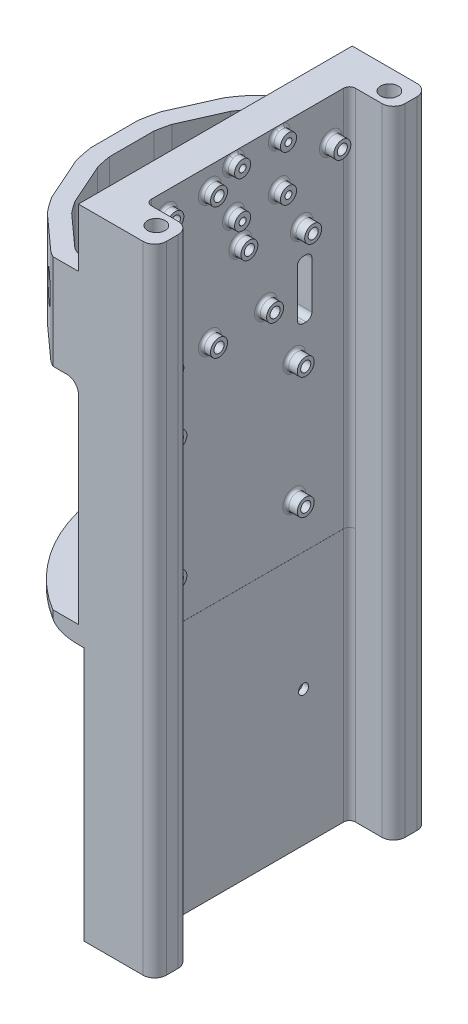
from build123d import *

# Parameters (mm, degrees)
SKETCH1_R                       = 69.85
BOSS_EXTRUDE1_DEPTH             = 12.7
BOSS_EXTRUDE2_START             = 254
BOSS_EXTRUDE2_DEPTH             = 254
SKETCH3_W                       = 6.35
SKETCH3_H                       = 80.01
SKETCH8_W                       = 51.494926749
SKETCH8_H                       = 127.916180553
CUT_EXTRUDE2_DEPTH              = 99.568
CUT_EXTRUDE3_DEPTH              = 7.62
CUT_EXTRUDE3_DEPTH_BACK         = 80.01
CUT_EXTRUDE3_START              = -173.99
SKETCH8_2_W                     = 51.494926749
SKETCH8_2_H                     = 127.916180553
CUT_EXTRUDE4_DEPTH              = 66.802
FILLET13_R                      = 5.08
FILLET3_R                       = 17.78
SKETCH11_R                      = 6.35
CUT_EXTRUDE6_DEPTH              = 14.986
CIRPATTERN1_COUNT               = 3
CIRPATTERN1_ANGLE               = 48
CIRPATTERN1_THE_OTHER_WAY_COUNT = 3
CIRPATTERN1_THE_OTHER_WAY_ANGLE = 48
BOSS_EXTRUDE3_DEPTH             = 7.62
SKETCH6_R                       = 3.81
CUT_EXTRUDE1_DEPTH              = 448.31
FILLET6_R                       = 5.08
SKETCH18_R                      = 2.2
FEATHERWEIGHT_GPS_DEPTH         = 5
SKETCH19_R                      = 2.2
BATTERY_MOUNTS_DEPTH            = 5
SKETCH21_R                      = 2.2
TELEMETRUM_HOLES_DEPTH          = 5
SKETCH22_R                      = 2.2
BLUE_RAVEN_HOLES_DEPTH          = 5
BOSS_EXTRUDE4_START             = 4
SKETCH22_5_R                    = 3.7
SKETCH22_5_R_2                  = 2.2
BOSS_EXTRUDE4_DEPTH             = 4
BOSS_EXTRUDE5_START             = 4
SKETCH21_4_R                    = 3.7
SKETCH21_4_R_2                  = 2.2
BOSS_EXTRUDE5_DEPTH             = 4
BOSS_EXTRUDE6_START             = 5
SKETCH18_3_R                    = 3.7
SKETCH18_3_R_2                  = 2.2
BOSS_EXTRUDE6_DEPTH             = 5
SKETCH23_R                      = 2.2
SRAD_HOLES_DEPTH                = 4
CUT_EXTRUDE11_START             = -12.7
SKETCH25_R                      = 73.406
CUT_EXTRUDE11_DEPTH             = 87.63
SKETCH27_R                      = 105.86041663
CUT_EXTRUDE12_DEPTH             = 22.606
CUT_EXTRUDE13_DEPTH             = 25.4
SKETCH31_R                      = 1.5
DVR_HOLES_DEPTH                 = 4
SKETCH31_3_R                    = 3.5
SKETCH31_3_R_2                  = 1.5
BOSS_EXTRUDE9_DEPTH             = 4
SKETCH32_R                      = 2.2
CUT_EXTRUDE17_DEPTH             = 5
FILLET9_R                       = 1.27
FILLET10_R                      = 1.27
FILLET11_R                      = 1.27
SKETCH23_6_R                    = 3.683
SKETCH23_6_R_2                  = 2.2
BOSS_EXTRUDE10_DEPTH            = 5
FILLET12_R                      = 1.27
SKETCH33_W                      = 25.134973306
SKETCH33_H                      = 41.402
CUT_EXTRUDE18_DEPTH             = 0.762
CIRPATTERN2_COUNT               = 3
CIRPATTERN2_ANGLE               = 48
CIRPATTERN2_THE_OTHER_WAY_COUNT = 3
CIRPATTERN2_THE_OTHER_WAY_ANGLE = 48
BOSS_EXTRUDE11_START            = -0.254
SKETCH35_W                      = 21.082
SKETCH35_H                      = 41.402
SKETCH35_R                      = 6.35
BOSS_EXTRUDE11_DEPTH            = 1.016
CIRPATTERN3_COUNT               = 3
CIRPATTERN3_ANGLE               = 48
CIRPATTERN3_THE_OTHER_WAY_COUNT = 3
CIRPATTERN3_THE_OTHER_WAY_ANGLE = 48
CUT_EXTRUDE21_DEPTH             = 265.731316086
SKETCH41_R                      = 3.81
BOSS_EXTRUDE12_DEPTH            = 110.744
CUT_EXTRUDE20_DEPTH             = 110.744
CUT_EXTRUDE20_DEPTH_BACK        = 2.54
SKETCH39_R                      = 2.2


with BuildPart() as part:
    # Sketch1 → Boss-Extrude1 (new body)
    with BuildSketch(Plane(origin=(0, 0, 0), x_dir=(1, 0, 0), z_dir=(0, 1, 0))):
        with Locations(Location((0, 0, 0), (0, 0, 270))):
            Circle(SKETCH1_R)
    extrude(amount=BOSS_EXTRUDE1_DEPTH)

    # Sketch2 → Boss-Extrude2 (add)
    with BuildSketch(Plane.XZ.offset(BOSS_EXTRUDE2_START)):
        with BuildLine():
            Line((-36.278456417, 59.69), (-7.068456417, 59.69))
            Line((-7.068456417, 59.69), (3.091543583, 59.69))
            ThreePointArc((3.091543583, 59.69), (6.683646031, 58.202102448), (8.171543583, 54.61))
            Line((8.171543583, 54.61), (8.171543583, 49.53))
            ThreePointArc((8.171543583, 49.53), (6.683646031, 45.937897552), (3.091543583, 44.45))
            Line((3.091543583, 44.45), (-8.510396002, 44.45))
            ThreePointArc((-8.510396002, 44.45), (-10.306447226, 43.706051224), (-11.050396002, 41.91))
            Line((-11.050396002, 41.91), (-11.050396002, -41.91))
            ThreePointArc((-11.050396002, -41.91), (-10.306447226, -43.706051224), (-8.510396002, -44.45))
            Line((-8.510396002, -44.45), (3.091543583, -44.45))
            ThreePointArc((3.091543583, -44.45), (6.683646031, -45.937897552), (8.171543583, -49.53))
            Line((8.171543583, -49.53), (8.171543583, -54.61))
            ThreePointArc((8.171543583, -54.61), (6.683646031, -58.202102448), (3.091543583, -59.69))
            Line((3.091543583, -59.69), (-7.068456417, -59.69))
            Line((-7.068456417, -59.69), (-36.278456417, -59.69))
            ThreePointArc((-36.278456417, -59.69), (-69.85, 0), (-36.278456417, 59.69))
        make_face()
    extrude(amount=-BOSS_EXTRUDE2_DEPTH)

    # Sketch3 → Cut-Revolve1 (revolve, cut)
    with BuildSketch(Plane.XY):
        with Locations((-66.675, -40.005)):
            Rectangle(SKETCH3_W, SKETCH3_H)
    revolve(axis=Axis((0, 0, 0), (0, 1, 0)), mode=Mode.SUBTRACT)

    # Sketch8 → Cut-Extrude2 (cut)
    with BuildSketch(Plane.XZ.offset(254)):
        with Locations((-50.833934193, -0.517879274)):
            Rectangle(SKETCH8_W, SKETCH8_H)
    extrude(amount=-CUT_EXTRUDE2_DEPTH, mode=Mode.SUBTRACT)

    # Sketch8<2> → Cut-Extrude3 (cut, two sides: drawn at the far end of the back side and taken through both)
    with BuildSketch(Plane.XZ.offset(254).offset(CUT_EXTRUDE3_START - CUT_EXTRUDE3_DEPTH_BACK)):
        with Locations((-50.833934193, -0.517879274)):
            Rectangle(SKETCH8_2_W, SKETCH8_2_H)
    extrude(amount=CUT_EXTRUDE3_DEPTH + CUT_EXTRUDE3_DEPTH_BACK, mode=Mode.SUBTRACT)

    # Sketch9 → Cut-Extrude4 (cut)
    with BuildSketch(Plane.XZ.offset(154.432)):
        with BuildLine():
            Line((-25.086470819, 53.552354019), (-31.964771747, 53.552354019))
            ThreePointArc((-31.964771747, 53.552354019), (-62.366667811, 0), (-31.964771747, -53.552354019))
            Line((-31.964771747, -53.552354019), (-25.086470819, -53.552354019))
            Line((-25.086470819, -53.552354019), (-25.086470819, 53.552354019))
        make_face()
    extrude(amount=-CUT_EXTRUDE4_DEPTH, mode=Mode.SUBTRACT)

    # Fillet13
    fillet13_edges = [part.edges().sort_by_distance(p)[0] for p in [
        (-25.086470819, -87.63, -56.62117701),
        (-25.086470819, -154.432, 56.62117701),
        (-25.086470819, -121.031, -53.552354019),
        (-25.086470819, -121.031, 53.552354019),
        (-25.086470819, -154.432, -56.62117701),
        (-25.086470819, -87.63, 56.62117701),
    ]]
    fillet(fillet13_edges, radius=FILLET13_R)

    # Fillet3
    # the kernel refuses this fillet: 17.78 mm, written as the material it adds along each edge
    with BuildSketch(Plane(origin=(-31.964771747, -154.432, -53.552354019), x_dir=(1, 0, 0), z_dir=(0, 1, 0))) as fillet3_piece_1:
        with BuildLine():
            CenterArc((6.062885135, -17.260988429), FILLET3_R, 103.877857389, 21.638365739)
            Line((-4.266111549, -2.788938557), (-4.472691483, -2.499497559))
            ThreePointArc((-4.472691483, -2.499497559), (-2.356138329, -1.053230113), (-0.182255574, 0.305342866))
            Line((-0.182255574, 0.305342866), (0, 0.3556))
            ThreePointArc((0, 0.3556), (0.899150464, 0.3556), (1.713009244, 0.345219769))
            Line((1.713009244, 0.345219769), (1.798300928, 0))
        make_face()
    extrude(amount=66.802)
    with BuildSketch(Plane(origin=(-31.964771747, -154.432, 53.552354019), x_dir=(1, 0, 0), z_dir=(0, 1, 0))) as fillet3_piece_2:
        with BuildLine():
            CenterArc((6.062885135, 17.260988429), FILLET3_R, 234.483776873, 21.638365739)
            Line((-4.266111549, 2.788938557), (-4.472691483, 2.499497559))
            ThreePointArc((-4.472691483, 2.499497559), (-2.356138329, 1.053230113), (-0.182255574, -0.305342866))
            Line((-0.182255574, -0.305342866), (0, -0.3556))
            ThreePointArc((0, -0.3556), (0.899150464, -0.3556), (1.713009244, -0.345219769))
            Line((1.713009244, -0.345219769), (1.798300928, 0))
        make_face()
    extrude(amount=66.802)

    # Sketch11 → Cut-Extrude6 (cut)
    with BuildSketch(Plane(origin=(-69.85, -87.63, 0), x_dir=(0, 0, 1), z_dir=(-1, 0, 0))):
        with Locations((0, -45.72)):
            Circle(SKETCH11_R)
    cut_extrude6 = extrude(amount=-CUT_EXTRUDE6_DEPTH, mode=Mode.SUBTRACT)

    # CirPattern1: Cut-Extrude6 ×3 about axis
    cirpattern1_axis = Axis((0, 0, 0), (0, 1, 0))
    for i in range(1, CIRPATTERN1_COUNT):
        add(cut_extrude6.rotate(cirpattern1_axis, i * CIRPATTERN1_ANGLE / (CIRPATTERN1_COUNT - 1)), mode=Mode.SUBTRACT)

    # CirPattern1 the other way: Cut-Extrude6 ×3 about axis
    cirpattern1_the_other_way_axis = Axis((0, 0, 0), (0, -1, 0))
    for i in range(1, CIRPATTERN1_THE_OTHER_WAY_COUNT):
        add(cut_extrude6.rotate(cirpattern1_the_other_way_axis, i * CIRPATTERN1_THE_OTHER_WAY_ANGLE / (CIRPATTERN1_THE_OTHER_WAY_COUNT - 1)), mode=Mode.SUBTRACT)

    # Sketch13 → Boss-Extrude3 (add)
    with BuildSketch(Plane.XZ.offset(254)):
        with BuildLine():
            Line((-36.278456417, 59.69), (-18.57051046, 59.69))
            ThreePointArc((-18.57051046, 59.69), (-14.978408012, 58.202102448), (-13.49051046, 54.61))
            Line((-13.49051046, 54.61), (-13.49051046, -54.61))
            ThreePointArc((-13.49051046, -54.61), (-14.978408012, -58.202102448), (-18.57051046, -59.69))
            Line((-18.57051046, -59.69), (-36.278456417, -59.69))
            ThreePointArc((-36.278456417, -59.69), (-69.85, 0), (-36.278456417, 59.69))
        make_face()
    extrude(amount=-BOSS_EXTRUDE3_DEPTH)

    # Sketch6 → Cut-Extrude1 (cut)
    with BuildSketch(Plane(origin=(0, 12.7, 0), x_dir=(1, 0, 0), z_dir=(0, 1, 0))):
        with Locations(Location((0, 50.8, 0), (0, 0, 270))):
            Circle(SKETCH6_R)
        with Locations(Location((0, -50.8, 0), (0, 0, 270))):
            Circle(SKETCH6_R)
    extrude(amount=-CUT_EXTRUDE1_DEPTH, mode=Mode.SUBTRACT)

    # Fillet6
    fillet6_edges = [part.edges().sort_by_distance(p)[0] for p in [
        (-69.85, -254, 0),
    ]]
    fillet(fillet6_edges, radius=FILLET6_R)

    # Sketch18 → Featherweight GPS (cut)
    with BuildSketch(Plane(origin=(-11.050396002, 0, 0), x_dir=(0, 0, -1), z_dir=(1, 0, 0))):
        with Locations((23.630408371, -130.916639993)):
            Circle(SKETCH18_R)
        with Locations((36.330408371, -105.516639993)):
            Circle(SKETCH18_R)
    extrude(amount=-FEATHERWEIGHT_GPS_DEPTH, mode=Mode.SUBTRACT)

    # Sketch19 → Battery Mounts (cut)
    with BuildSketch(Plane.ZY.offset(25.086470819)):
        with Locations((-42, -204.891080852)):
            Circle(SKETCH19_R)
        with Locations((-21, -204.891080852)):
            Circle(SKETCH19_R)
        with Locations((0, -204.891080852)):
            Circle(SKETCH19_R)
        with Locations((21, -204.891080852)):
            Circle(SKETCH19_R)
        with Locations((42, -204.891080852)):
            Circle(SKETCH19_R)
    extrude(amount=-BATTERY_MOUNTS_DEPTH, mode=Mode.SUBTRACT)

    # Sketch21 → Telemetrum Holes (cut)
    with BuildSketch(Plane(origin=(-11.050396002, 0, 0), x_dir=(0, 0, -1), z_dir=(1, 0, 0))):
        with Locations((-35.475786378, -97.243458943)):
            Circle(SKETCH21_R)
        with Locations((-16.425786378, -97.243458943)):
            Circle(SKETCH21_R)
        with Locations((-35.475786378, -154.393458943)):
            Circle(SKETCH21_R)
        with Locations((-16.425786378, -154.393458943)):
            Circle(SKETCH21_R)
    extrude(amount=-TELEMETRUM_HOLES_DEPTH, mode=Mode.SUBTRACT)

    # Sketch22 → Blue Raven Holes (cut)
    with BuildSketch(Plane(origin=(-11.050396002, 0, 0), x_dir=(0, 0, -1), z_dir=(1, 0, 0))):
        with Locations((-3.202157139, -124.186848052)):
            Circle(SKETCH22_R)
        with Locations((8.028979611, -153.396848052)):
            Circle(SKETCH22_R)
    extrude(amount=-BLUE_RAVEN_HOLES_DEPTH, mode=Mode.SUBTRACT)

    # Sketch22<5> → Boss-Extrude4 (add)
    # profile 1 of 2: a face of its own
    with BuildSketch(Plane(origin=(-11.050396002, 0, 0), x_dir=(0, 0, -1), z_dir=(1, 0, 0)).offset(BOSS_EXTRUDE4_START)):
        with Locations(Location((-3.202157139, -124.186848052, 0), (0, 0, 180))):
            Circle(SKETCH22_5_R)
        with Locations((-3.202157139, -124.186848052)):
            Circle(SKETCH22_5_R_2, mode=Mode.SUBTRACT)
    # profile 2 of 2: a face of its own
    with BuildSketch(Plane(origin=(-11.050396002, 0, 0), x_dir=(0, 0, -1), z_dir=(1, 0, 0)).offset(BOSS_EXTRUDE4_START)):
        with Locations(Location((8.028979611, -153.396848052, 0), (0, 0, 180))):
            Circle(SKETCH22_5_R)
        with Locations((8.028979611, -153.396848052)):
            Circle(SKETCH22_5_R_2, mode=Mode.SUBTRACT)
    extrude(amount=-BOSS_EXTRUDE4_DEPTH)

    # Sketch21<4> → Boss-Extrude5 (add)
    # profile 1 of 4: a face of its own
    with BuildSketch(Plane(origin=(-11.050396002, 0, 0), x_dir=(0, 0, -1), z_dir=(1, 0, 0)).offset(BOSS_EXTRUDE5_START)):
        with Locations(Location((-35.475786378, -97.243458943, 0), (0, 0, 180))):
            Circle(SKETCH21_4_R)
        with Locations((-35.475786378, -97.243458943)):
            Circle(SKETCH21_4_R_2, mode=Mode.SUBTRACT)
    # profile 2 of 4: a face of its own
    with BuildSketch(Plane(origin=(-11.050396002, 0, 0), x_dir=(0, 0, -1), z_dir=(1, 0, 0)).offset(BOSS_EXTRUDE5_START)):
        with Locations(Location((-16.425786378, -97.243458943, 0), (0, 0, 180))):
            Circle(SKETCH21_4_R)
        with Locations((-16.425786378, -97.243458943)):
            Circle(SKETCH21_4_R_2, mode=Mode.SUBTRACT)
    # profile 3 of 4: a face of its own
    with BuildSketch(Plane(origin=(-11.050396002, 0, 0), x_dir=(0, 0, -1), z_dir=(1, 0, 0)).offset(BOSS_EXTRUDE5_START)):
        with Locations(Location((-35.475786378, -154.393458943, 0), (0, 0, 180))):
            Circle(SKETCH21_4_R)
        with Locations((-35.475786378, -154.393458943)):
            Circle(SKETCH21_4_R_2, mode=Mode.SUBTRACT)
    # profile 4 of 4: a face of its own
    with BuildSketch(Plane(origin=(-11.050396002, 0, 0), x_dir=(0, 0, -1), z_dir=(1, 0, 0)).offset(BOSS_EXTRUDE5_START)):
        with Locations(Location((-16.425786378, -154.393458943, 0), (0, 0, 180))):
            Circle(SKETCH21_4_R)
        with Locations((-16.425786378, -154.393458943)):
            Circle(SKETCH21_4_R_2, mode=Mode.SUBTRACT)
    extrude(amount=-BOSS_EXTRUDE5_DEPTH)

    # Sketch18<3> → Boss-Extrude6 (add)
    # profile 1 of 2: a face of its own
    with BuildSketch(Plane(origin=(-11.050396002, 0, 0), x_dir=(0, 0, -1), z_dir=(1, 0, 0)).offset(BOSS_EXTRUDE6_START)):
        with Locations(Location((23.630408371, -130.916639993, 0), (0, 0, 180))):
            Circle(SKETCH18_3_R)
        with Locations((23.630408371, -130.916639993)):
            Circle(SKETCH18_3_R_2, mode=Mode.SUBTRACT)
    # profile 2 of 2: a face of its own
    with BuildSketch(Plane(origin=(-11.050396002, 0, 0), x_dir=(0, 0, -1), z_dir=(1, 0, 0)).offset(BOSS_EXTRUDE6_START)):
        with Locations(Location((36.330408371, -105.516639993, 0), (0, 0, 180))):
            Circle(SKETCH18_3_R)
        with Locations((36.330408371, -105.516639993)):
            Circle(SKETCH18_3_R_2, mode=Mode.SUBTRACT)
    extrude(amount=-BOSS_EXTRUDE6_DEPTH)

    # Sketch23 → SRAD Holes (cut)
    with BuildSketch(Plane(origin=(-11.050396002, 0, 0), x_dir=(0, 0, -1), z_dir=(1, 0, 0))):
        with Locations((-35.121812791, -179.485326742)):
            Circle(SKETCH23_R)
        with Locations((20.378187209, -179.485326742)):
            Circle(SKETCH23_R)
        with Locations((-35.121812791, -232.485326742)):
            Circle(SKETCH23_R)
        with Locations((20.378187209, -232.485326742)):
            Circle(SKETCH23_R)
    extrude(amount=-SRAD_HOLES_DEPTH, mode=Mode.SUBTRACT)

    # Sketch25 → Cut-Extrude11 (cut)
    with BuildSketch(Plane(origin=(0, 12.7, 0), x_dir=(1, 0, 0), z_dir=(0, 1, 0)).offset(CUT_EXTRUDE11_START)):
        Circle(SKETCH25_R)
    extrude(amount=-CUT_EXTRUDE11_DEPTH, mode=Mode.SUBTRACT)


with BuildPart() as cut_extrude11_piece_1:
    # of the separate pieces the step leaves, piece 1, a body of its own (cut_extrude11_pieces)
    add(part.part.solids().sort_by_distance((-25.144717139, -254, 59.69))[0])

    # Sketch28 → Cut-Extrude13 (cut)
    with BuildSketch(Plane(origin=(0, -87.63, 0), x_dir=(1, 0, 0), z_dir=(0, 1, 0))):
        with BuildLine():
            Line((-25.086470819, -65.189657783), (-25.086470819, 65.189657783))
            ThreePointArc((-25.086470819, 65.189657783), (-69.85, 0), (-25.086470819, -65.189657783))
        make_face()
    extrude(amount=-CUT_EXTRUDE13_DEPTH, mode=Mode.SUBTRACT)

    # Sketch31 → DVR Holes (cut)
    with BuildSketch(Plane(origin=(-11.050396002, 0, 0), x_dir=(0, 0, -1), z_dir=(1, 0, 0))):
        with Locations((-6.137953822, -91.979966401)):
            Circle(SKETCH31_R)
        with Locations((13.862046178, -91.979966401)):
            Circle(SKETCH31_R)
        with Locations((-6.137953822, -111.979966401)):
            Circle(SKETCH31_R)
        with Locations((13.862046178, -111.979966401)):
            Circle(SKETCH31_R)
    extrude(amount=-DVR_HOLES_DEPTH, mode=Mode.SUBTRACT)

    # Sketch31<3> → Boss-Extrude9 (add)
    # profile 1 of 4: a face of its own
    with BuildSketch(Plane(origin=(-11.050396002, 0, 0), x_dir=(0, 0, -1), z_dir=(1, 0, 0))):
        with Locations(Location((-6.137953822, -91.979966401, 0), (0, 0, 180))):
            Circle(SKETCH31_3_R)
        with Locations((-6.137953822, -91.979966401)):
            Circle(SKETCH31_3_R_2, mode=Mode.SUBTRACT)
    # profile 2 of 4: a face of its own
    with BuildSketch(Plane(origin=(-11.050396002, 0, 0), x_dir=(0, 0, -1), z_dir=(1, 0, 0))):
        with Locations(Location((13.862046178, -91.979966401, 0), (0, 0, 180))):
            Circle(SKETCH31_3_R)
        with Locations((13.862046178, -91.979966401)):
            Circle(SKETCH31_3_R_2, mode=Mode.SUBTRACT)
    # profile 3 of 4: a face of its own
    with BuildSketch(Plane(origin=(-11.050396002, 0, 0), x_dir=(0, 0, -1), z_dir=(1, 0, 0))):
        with Locations(Location((13.862046178, -111.979966401, 0), (0, 0, 180))):
            Circle(SKETCH31_3_R)
        with Locations((13.862046178, -111.979966401)):
            Circle(SKETCH31_3_R_2, mode=Mode.SUBTRACT)
    # profile 4 of 4: a face of its own
    with BuildSketch(Plane(origin=(-11.050396002, 0, 0), x_dir=(0, 0, -1), z_dir=(1, 0, 0))):
        with Locations(Location((-6.137953822, -111.979966401, 0), (0, 0, 180))):
            Circle(SKETCH31_3_R)
        with Locations((-6.137953822, -111.979966401)):
            Circle(SKETCH31_3_R_2, mode=Mode.SUBTRACT)
    extrude(amount=BOSS_EXTRUDE9_DEPTH)

    # Sketch32 → Cut-Extrude17 (cut)
    with BuildSketch(Plane.ZY.offset(25.086470819)):
        with Locations((0, -99.040462544)):
            Circle(SKETCH32_R)
    extrude(amount=-CUT_EXTRUDE17_DEPTH, mode=Mode.SUBTRACT)

    # Fillet9
    fillet9_edges = [cut_extrude11_piece_1.edges().sort_by_distance(p)[0] for p in [
        (-11.050396002, -130.916639993, -27.330408371),
        (-11.050396002, -105.516639993, -40.030408371),
    ]]
    fillet(fillet9_edges, radius=FILLET9_R)

    # Fillet10
    fillet10_edges = [cut_extrude11_piece_1.edges().sort_by_distance(p)[0] for p in [
        (-11.050396002, -153.396848052, -11.728979611),
        (-11.050396002, -154.393458943, 31.775786378),
        (-11.050396002, -154.393458943, 12.725786378),
        (-11.050396002, -97.243458943, 12.725786378),
        (-11.050396002, -97.243458943, 31.775786378),
        (-11.050396002, -124.186848052, -0.497842861),
    ]]
    fillet(fillet10_edges, radius=FILLET10_R)

    # Fillet11
    fillet11_edges = [cut_extrude11_piece_1.edges().sort_by_distance(p)[0] for p in [
        (-11.050396002, -91.979966401, -17.362046178),
        (-11.050396002, -111.979966401, 2.637953822),
        (-11.050396002, -91.979966401, 2.637953822),
        (-11.050396002, -111.979966401, -17.362046178),
    ]]
    fillet(fillet11_edges, radius=FILLET11_R)

    # Sketch23<6> → Boss-Extrude10 (add)
    # profile 1 of 4: a face of its own
    with BuildSketch(Plane(origin=(-11.050396002, 0, 0), x_dir=(0, 0, -1), z_dir=(1, 0, 0))):
        with Locations(Location((-35.121812791, -179.485326742, 0), (0, 0, 180))):
            Circle(SKETCH23_6_R)
        with Locations((-35.121812791, -179.485326742)):
            Circle(SKETCH23_6_R_2, mode=Mode.SUBTRACT)
    # profile 2 of 4: a face of its own
    with BuildSketch(Plane(origin=(-11.050396002, 0, 0), x_dir=(0, 0, -1), z_dir=(1, 0, 0))):
        with Locations(Location((20.378187209, -179.485326742, 0), (0, 0, 180))):
            Circle(SKETCH23_6_R)
        with Locations((20.378187209, -179.485326742)):
            Circle(SKETCH23_6_R_2, mode=Mode.SUBTRACT)
    # profile 3 of 4: a face of its own
    with BuildSketch(Plane(origin=(-11.050396002, 0, 0), x_dir=(0, 0, -1), z_dir=(1, 0, 0))):
        with Locations(Location((-35.121812791, -232.485326742, 0), (0, 0, 180))):
            Circle(SKETCH23_6_R)
        with Locations((-35.121812791, -232.485326742)):
            Circle(SKETCH23_6_R_2, mode=Mode.SUBTRACT)
    # profile 4 of 4: a face of its own
    with BuildSketch(Plane(origin=(-11.050396002, 0, 0), x_dir=(0, 0, -1), z_dir=(1, 0, 0))):
        with Locations(Location((20.378187209, -232.485326742, 0), (0, 0, 180))):
            Circle(SKETCH23_6_R)
        with Locations((20.378187209, -232.485326742)):
            Circle(SKETCH23_6_R_2, mode=Mode.SUBTRACT)
    extrude(amount=BOSS_EXTRUDE10_DEPTH)

    # Fillet12
    fillet12_edges = [cut_extrude11_piece_1.edges().sort_by_distance(p)[0] for p in [
        (-11.050396002, -179.485326742, 31.438812791),
        (-11.050396002, -232.485326742, -24.061187209),
        (-11.050396002, -232.485326742, 31.438812791),
        (-11.050396002, -179.485326742, -24.061187209),
    ]]
    fillet(fillet12_edges, radius=FILLET12_R)

    # Sketch33 → Cut-Extrude18 (cut)
    with BuildSketch(Plane(origin=(-69.85, -87.63, 0), x_dir=(0, 0, 1), z_dir=(-1, 0, 0))):
        with Locations((0, -46.101)):
            Rectangle(SKETCH33_W, SKETCH33_H)
    cut_extrude18 = extrude(amount=-CUT_EXTRUDE18_DEPTH, mode=Mode.SUBTRACT)

    # CirPattern2: Cut-Extrude18 ×3 about axis
    cirpattern2_axis = Axis((0, 0, 0), (0, 1, 0))
    for i in range(1, CIRPATTERN2_COUNT):
        add(cut_extrude18.rotate(cirpattern2_axis, i * CIRPATTERN2_ANGLE / (CIRPATTERN2_COUNT - 1)), mode=Mode.SUBTRACT)

    # CirPattern2 the other way: Cut-Extrude18 ×3 about axis
    cirpattern2_the_other_way_axis = Axis((0, 0, 0), (0, -1, 0))
    for i in range(1, CIRPATTERN2_THE_OTHER_WAY_COUNT):
        add(cut_extrude18.rotate(cirpattern2_the_other_way_axis, i * CIRPATTERN2_THE_OTHER_WAY_ANGLE / (CIRPATTERN2_THE_OTHER_WAY_COUNT - 1)), mode=Mode.SUBTRACT)

    # Sketch35 → Boss-Extrude11 (add)
    with BuildSketch(Plane(origin=(-62.366667811, 0, 0), x_dir=(0, 0, -1), z_dir=(1, 0, 0)).offset(BOSS_EXTRUDE11_START)):
        with Locations((0, -133.731)):
            Rectangle(SKETCH35_W, SKETCH35_H)
        with Locations((0, -133.35)):
            Circle(SKETCH35_R, mode=Mode.SUBTRACT)
    boss_extrude11 = extrude(amount=BOSS_EXTRUDE11_DEPTH)

    # CirPattern3: Boss-Extrude11 ×3 about axis
    cirpattern3_axis = Axis((0, 0, 0), (0, -1, 0))
    for i in range(1, CIRPATTERN3_COUNT):
        add(boss_extrude11.rotate(cirpattern3_axis, i * CIRPATTERN3_ANGLE / (CIRPATTERN3_COUNT - 1)))

    # CirPattern3 the other way: Boss-Extrude11 ×3 about axis
    cirpattern3_the_other_way_axis = Axis((0, 0, 0), (0, 1, 0))
    for i in range(1, CIRPATTERN3_THE_OTHER_WAY_COUNT):
        add(boss_extrude11.rotate(cirpattern3_the_other_way_axis, i * CIRPATTERN3_THE_OTHER_WAY_ANGLE / (CIRPATTERN3_THE_OTHER_WAY_COUNT - 1)))

    # Sketch29 → Cut-Extrude21 (cut, through all)
    with BuildSketch(Plane.ZY.offset(25.086470819)):
        with BuildLine():
            Line((-25.528612361, -167.726063036), (-24.258612361, -167.726063036))
            ThreePointArc((-24.258612361, -167.726063036), (-22.462561137, -166.98211426), (-21.718612361, -165.186063036))
            Line((-21.718612361, -165.186063036), (-21.718612361, -144.866063036))
            ThreePointArc((-21.718612361, -144.866063036), (-22.462561137, -143.070011811), (-24.258612361, -142.326063036))
            Line((-24.258612361, -142.326063036), (-25.528612361, -142.326063036))
            ThreePointArc((-25.528612361, -142.326063036), (-27.324663586, -143.070011811), (-28.068612361, -144.866063036))
            Line((-28.068612361, -144.866063036), (-28.068612361, -165.186063036))
            ThreePointArc((-28.068612361, -165.186063036), (-27.324663586, -166.98211426), (-25.528612361, -167.726063036))
        make_face()
    extrude(amount=-CUT_EXTRUDE21_DEPTH, mode=Mode.SUBTRACT)

    # Sketch41 → Boss-Extrude12 (add)
    with BuildSketch(Plane.XZ.offset(254)):
        with BuildLine():
            Line((-8.486586778, -44.45), (3.091543583, -44.45))
            ThreePointArc((3.091543583, -44.45), (6.683646031, -45.937897552), (8.171543583, -49.53))
            Line((8.171543583, -49.53), (8.171543583, -54.61))
            ThreePointArc((8.171543583, -54.61), (6.683646031, -58.202102448), (3.091543583, -59.69))
            Line((3.091543583, -59.69), (-22.57839875, -59.69))
            Line((-22.57839875, -59.69), (-22.57839875, 59.69))
            Line((-22.57839875, 59.69), (3.091543583, 59.69))
            ThreePointArc((3.091543583, 59.69), (6.683646031, 58.202102448), (8.171543583, 54.61))
            Line((8.171543583, 54.61), (8.171543583, 49.53))
            ThreePointArc((8.171543583, 49.53), (6.683646031, 45.937897552), (3.091543583, 44.45))
            Line((3.091543583, 44.45), (-8.486586778, 44.45))
            ThreePointArc((-8.486586778, 44.45), (-10.282638002, 43.706051224), (-11.026586778, 41.91))
            Line((-11.026586778, 41.91), (-11.026586778, -41.91))
            ThreePointArc((-11.026586778, -41.91), (-10.282638002, -43.706051224), (-8.486586778, -44.45))
        make_face()
        with Locations(Location((0, 50.8, 0), (0, 0, 90))):
            Circle(SKETCH41_R, mode=Mode.SUBTRACT)
        with Locations(Location((0, -50.8, 0), (0, 0, 90))):
            Circle(SKETCH41_R, mode=Mode.SUBTRACT)
    extrude(amount=BOSS_EXTRUDE12_DEPTH)

    # Sketch39 → Cut-Extrude20 (cut, two sides: drawn at the far end of the back side and taken through both)
    with BuildSketch(Plane(origin=(-11.050396002, 0, 0), x_dir=(0, 0, -1), z_dir=(1, 0, 0)).offset(-CUT_EXTRUDE20_DEPTH_BACK)):
        with Locations(Location((-35.121812791, -305.788326742, 0), (0, 0, 180))):
            Circle(SKETCH39_R)
        with Locations(Location((24.378187209, -305.788326742, 0), (0, 0, 180))):
            Circle(SKETCH39_R)
    extrude(amount=CUT_EXTRUDE20_DEPTH + CUT_EXTRUDE20_DEPTH_BACK, mode=Mode.SUBTRACT)


with BuildPart() as cut_extrude11_piece_2:
    # of the separate pieces the step leaves, piece 2, a body of its own (cut_extrude11_pieces)
    add(part.part.solids().sort_by_distance((0, 0, 69.85))[0])

    # Sketch27 → Cut-Extrude12 (cut)
    with BuildSketch(Plane(origin=(0, 12.7, 0), x_dir=(1, 0, 0), z_dir=(0, 1, 0))):
        Circle(SKETCH27_R)
    extrude(amount=-CUT_EXTRUDE12_DEPTH, mode=Mode.SUBTRACT)


solid = cut_extrude11_piece_1.part
